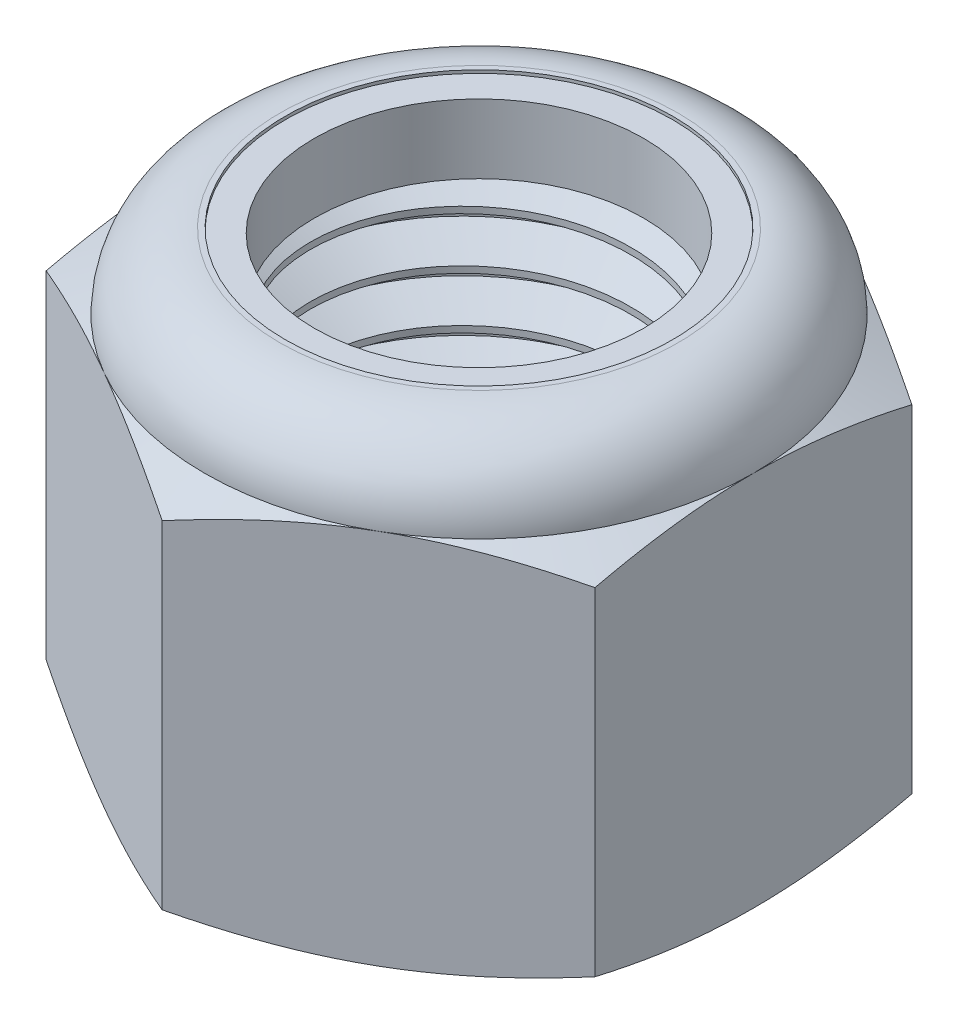
from build123d import *

# Parameters (mm, degrees)
SKETCH1_R        = 9.525
EXTRUDE1_DEPTH   = 22.225
SKETCH2_W        = 9.525
SKETCH2_H        = 18.520833333
CUT_SWEEP1_PITCH = 2.54
SKETCH12_W       = 10.4775
SKETCH12_H       = 18.520833333


with BuildPart() as part:
    # Sketch1 → Extrude1 (new body)
    with BuildSketch(Plane(origin=(0, 0, 0), x_dir=(1, 0, 0), z_dir=(0, 1, 0))):
        Polygon((0, 15.58124039), (-13.49375, 7.790620195), (-13.49375, -7.790620195), (0, -15.58124039), (13.49375, -7.790620195), (13.49375, 7.790620195), align=None)
        with Locations(Location((0, 0, 0), (0, 0, 270))):
            Circle(SKETCH1_R, mode=Mode.SUBTRACT)
    extrude(amount=EXTRUDE1_DEPTH)

    # Sketch5 → Cut-Revolve3 (revolve, cut)
    with BuildSketch(Plane(origin=(0, 0, 0), x_dir=(0, 0, -1), z_dir=(1, 0, 0))):
        with BuildLine():
            Line((0, 0), (13.49375, 0))
            Line((13.49375, 0), (15.58124039, 0.973412755))
            Line((15.58124039, 0.973412755), (15.58124039, 17.547420578))
            Line((15.58124039, 17.547420578), (13.49375, 18.520833333))
            ThreePointArc((13.49375, 18.520833333), (12.408824702, 21.140074702), (9.789583333, 22.225))
            Line((9.789583333, 22.225), (9.789583333, 23.495))
            Line((9.789583333, 23.495), (16.85124039, 23.495))
            Line((16.85124039, 23.495), (16.85124039, -1.27))
            Line((16.85124039, -1.27), (0, -1.27))
            Line((0, -1.27), (0, 0))
        make_face()
    revolve(axis=Axis((0, 0, 0), (0, 1, 0)), mode=Mode.SUBTRACT)

    # Sketch6 → Cut-Revolve4 (revolve, cut)
    with BuildSketch(Plane(origin=(0, 0, 0), x_dir=(0, 0, -1), z_dir=(1, 0, 0)), mode=Mode.PRIVATE) as cut_revolve4_sk:
        with BuildLine():
            Line((0, 18.520833333), (13.34135, 18.520833333))
            ThreePointArc((13.34135, 18.520833333), (12.301061629, 21.032311629), (9.789583333, 22.0726))
            Line((9.789583333, 22.0726), (4.894791667, 22.0726))
            Line((4.894791667, 22.0726), (4.894791667, 23.495))
            Line((4.894791667, 23.495), (0, 23.495))
            Line((0, 23.495), (0, 18.520833333))
        make_face()
    revolve(cut_revolve4_sk.sketch.rotate(Axis((0, 23.495, 0), (0, -1, 0)), 180), axis=Axis((0, 23.495, 0), (0, -1, 0)), mode=Mode.SUBTRACT)

    # Sketch4 → Cut-Revolve2 (revolve, cut)
    with BuildSketch(Plane(origin=(0, 0, 0), x_dir=(0, 0, -1), z_dir=(1, 0, 0))):
        Polygon((0, 18.520833333), (10.4775, 18.520833333), (0, 13.635094845), align=None)
        Polygon((0, 4.885738488), (10.4775, 0), (0, 0), align=None)
    revolve(axis=Axis((0, 0, 0), (0, 1, 0)), mode=Mode.SUBTRACT)

    # Sketch12 → Revolve4 (revolve)
    with BuildSketch(Plane(origin=(0, 0, 0), x_dir=(0, 0, -1), z_dir=(1, 0, 0)), mode=Mode.PRIVATE) as revolve4_sk:
        with Locations((5.23875, 9.260416667)):
            Rectangle(SKETCH12_W, SKETCH12_H)
    revolve(revolve4_sk.sketch.rotate(Axis((0, 0, 0), (0, 1, 0)), 3.028045303), axis=Axis((0, 0, 0), (0, 1, 0)))


with BuildPart() as body_2:
    # Sketch7 → Revolve2 (revolve)
    with BuildSketch(Plane(origin=(0, 0, 0), x_dir=(0, 0, -1), z_dir=(1, 0, 0))):
        with BuildLine():
            Line((8.09625, 18.597033333), (13.264314577, 18.597033333))
            ThreePointArc((13.264314577, 18.597033333), (12.220090017, 21.005224791), (9.789583333, 21.9964))
            Line((9.789583333, 21.9964), (8.09625, 21.9964))
            Line((8.09625, 21.9964), (8.09625, 18.597033333))
        make_face()
    revolve(axis=Axis((0, 18.597033333, 0), (0, 1, 0)))


with BuildPart() as body_3:
    # Sketch2 → Revolve1 (revolve)
    with BuildSketch(Plane(origin=(0, 0, 0), x_dir=(0, 0, -1), z_dir=(1, 0, 0))):
        with Locations((4.7625, 9.260416667)):
            Rectangle(SKETCH2_W, SKETCH2_H)
    revolve(axis=Axis((0, -9.525, 0), (0, 1, 0)))

    # Cut-Sweep1: the profile of Sketch9 screwed along a right-hand helix of 9.75 turns, 10 arcs to a turn; built about Z, then put on its axis
    cut_sweep1_z = Axis((0, 0, 0), (0, 0, 1))
    cut_sweep1_corners = [(9.799963066, 0, 0.15875), (9.662481533, 0, -2.301875), (7.875221606, 0, -1.27), (7.875221606, 0, -0.9525)]
    with BuildLine(mode=Mode.PRIVATE) as cut_sweep1_profile:
        Line(cut_sweep1_corners[0], cut_sweep1_corners[1])
        Line(cut_sweep1_corners[1], cut_sweep1_corners[2])
        Line(cut_sweep1_corners[2], cut_sweep1_corners[3])
        Line(cut_sweep1_corners[3], cut_sweep1_corners[0])
    cut_sweep1_cap = Face(cut_sweep1_profile.wire())
    cut_sweep1_turn_angles = [0, 18, 36, 54, 72, 90, 108, 126, 144, 162, 180, 198, 216, 234, 252, 270, 288, 306, 324, 342, 360]
    cut_sweep1_turn_weights = [1, 0.9510565162951535, 1, 0.9510565162951535, 1, 0.9510565162951535, 1, 0.9510565162951535, 1, 0.9510565162951535, 1, 0.9510565162951535, 1, 0.9510565162951535, 1, 0.9510565162951535, 1, 0.9510565162951535, 1, 0.9510565162951535, 1]
    cut_sweep1_turn_rails = [Edge.make_bspline([Vector(p[0], p[1], 0).rotate(cut_sweep1_z, cut_sweep1_turn_angles[k]) / cut_sweep1_turn_weights[k] + Vector(0, 0, p[2] + CUT_SWEEP1_PITCH * cut_sweep1_turn_angles[k] / 360) for k in range(21)], [0, 0, 0, 1, 1, 2, 2, 3, 3, 4, 4, 5, 5, 6, 6, 7, 7, 8, 8, 9, 9, 10, 10, 10], 2, cut_sweep1_turn_weights) for p in cut_sweep1_corners]
    cut_sweep1_turn_sides = [Face.make_surface_from_curves(cut_sweep1_turn_rails[p[0]], cut_sweep1_turn_rails[p[1]]) for p in [(0, 1), (1, 2), (2, 3), (3, 0)]]
    cut_sweep1_last_angles = [3240, 3258, 3276, 3294, 3312, 3330, 3348, 3366, 3384, 3402, 3420, 3438, 3456, 3474, 3492, 3501, 3510]
    cut_sweep1_last_weights = [1, 0.9510565162951535, 1, 0.9510565162951535, 1, 0.9510565162951535, 1, 0.9510565162951535, 1, 0.9510565162951535, 1, 0.9510565162951535, 1, 0.9510565162951535, 1, 0.9876883405951086, 1]
    cut_sweep1_last_rails = [Edge.make_bspline([Vector(p[0], p[1], 0).rotate(cut_sweep1_z, cut_sweep1_last_angles[k]) / cut_sweep1_last_weights[k] + Vector(0, 0, p[2] + CUT_SWEEP1_PITCH * cut_sweep1_last_angles[k] / 360) for k in range(17)], [0, 0, 0, 1, 1, 2, 2, 3, 3, 4, 4, 5, 5, 6, 6, 7, 7, 8, 8, 8], 2, cut_sweep1_last_weights) for p in cut_sweep1_corners]
    cut_sweep1_last_sides = [Face.make_surface_from_curves(cut_sweep1_last_rails[p[0]], cut_sweep1_last_rails[p[1]]) for p in [(0, 1), (1, 2), (2, 3), (3, 0)]]
    cut_sweep1 = Plane(origin=(0, 18.520833333, 0), x_dir=(0, 0, -1), z_dir=(0, -1, 0)) * Solid(Shell([*[p.moved(Location((0, 0, CUT_SWEEP1_PITCH * i))) for i in range(9) for p in cut_sweep1_turn_sides], *cut_sweep1_last_sides, cut_sweep1_cap, cut_sweep1_cap.rotate(cut_sweep1_z, 3510).moved(Location((0, 0, CUT_SWEEP1_PITCH * 3510 / 360)))]))
    add(cut_sweep1, mode=Mode.SUBTRACT)

    # Sketch11 → Revolve3 (revolve)
    with BuildSketch(Plane(origin=(0, 0, 0), x_dir=(0, 0, -1), z_dir=(1, 0, 0))):
        Polygon((0, 0), (10.4775, 0), (0, 4.885738488), align=None)
    revolve(axis=Axis((0, 22.225, 0), (0, -1, 0)))


with BuildPart() as part_1:
    add(part.part)

    # Combine1: cut body 3
    add(body_3.part, mode=Mode.SUBTRACT)


solid = Compound([body_2.part, part_1.part])
